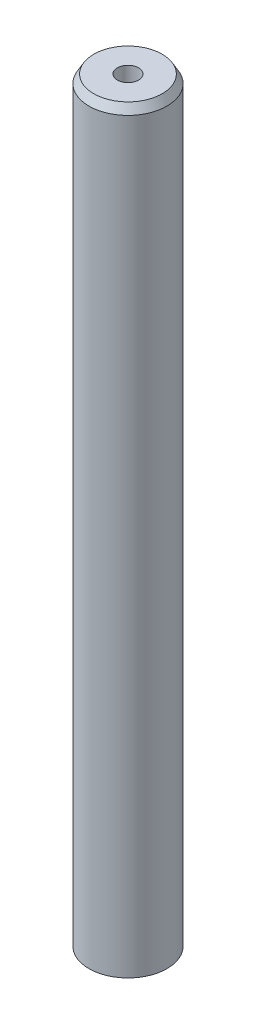
from build123d import *
from OCP.BRepFilletAPI import BRepFilletAPI_MakeChamfer

# Parameters (mm, degrees)
SKETCH1_R           = 12.5
BOSS_EXTRUDE1_DEPTH = 243.666036296
SKETCH2_R           = 3.408545289
CUT_EXTRUDE1_DEPTH  = 245.306441266
CHAMFER1_SIZE       = 2.675315847
CHAMFER1_SIZE2      = 1.522656458


with BuildPart() as part:
    # Sketch1 → Boss-Extrude1 (new body)
    with BuildSketch(Plane(origin=(0, 0, 0), x_dir=(1, 0, 0), z_dir=(0, 1, 0))):
        Circle(SKETCH1_R)
    extrude(amount=BOSS_EXTRUDE1_DEPTH)

    # Sketch2 → Cut-Extrude1 (cut, through all)
    with BuildSketch(Plane(origin=(0, 0, 0), x_dir=(1, 0, 0), z_dir=(0, 1, 0))):
        Circle(SKETCH2_R)
    extrude(amount=CUT_EXTRUDE1_DEPTH, mode=Mode.SUBTRACT)

    # Chamfer1: one chamfer whose edges measure the first distance from different faces: ONE call of the kernel's chamfer builder (chamfer() names one face for all edges)
    chamfer1_edges_1 = [part.edges().sort_by_distance(p)[0] for p in [
        (-12.5, 243.666036296, 0),
    ]]
    chamfer1_side_1 = [part.faces().sort_by_distance(p)[0] for p in [
        (-12.5, 121.833018148, 0),
    ]]
    chamfer1_edges_2 = [part.edges().sort_by_distance(p)[0] for p in [
        (-12.5, 0, 0),
    ]]
    chamfer1_side_2 = [part.faces().sort_by_distance(p)[0] for p in [
        (-12.146446609, 0, 0),
    ]]
    chamfer1 = BRepFilletAPI_MakeChamfer(part.part.solid().wrapped)
    for e in chamfer1_edges_1:
        chamfer1.Add(CHAMFER1_SIZE, CHAMFER1_SIZE2, e.wrapped, chamfer1_side_1[0].wrapped)  # the first distance lies on this face
    for e in chamfer1_edges_2:
        chamfer1.Add(CHAMFER1_SIZE, CHAMFER1_SIZE2, e.wrapped, chamfer1_side_2[0].wrapped)  # the first distance lies on this face
    add(Compound.cast(chamfer1.Shape()), mode=Mode.REPLACE)


solid = part.part
